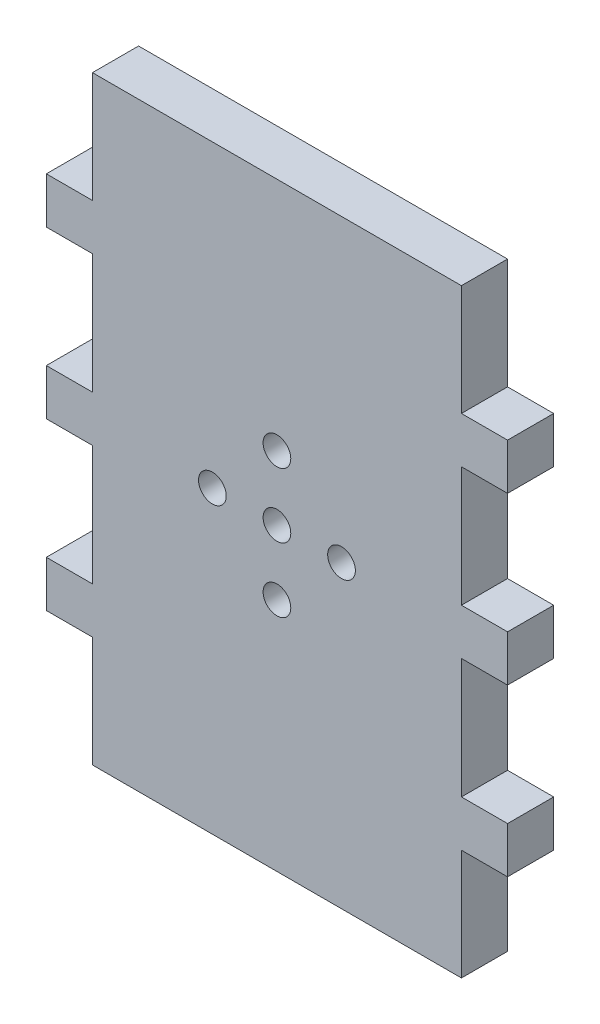
from build123d import *

# Parameters (mm, degrees)
SKETCH_3_R      = 1.5
EXTRUDE_2_DEPTH = 5


with BuildPart() as part:
    # 草图3 → 凸台-拉伸2 (new body)
    with BuildSketch(Plane.XY):
        Polygon((0, 0), (0, -12), (-5, -12), (-5, -17), (0, -17), (0, -30), (-5, -30), (-5, -35), (0, -35), (0, -48), (-5, -48), (-5, -53), (0, -53), (0, -65), (40, -65), (40, -53), (45, -53), (45, -48), (40, -48), (40, -35), (45, -35), (45, -30), (40, -30), (40, -17), (45, -17), (45, -12), (40, -12), (40, 0), align=None)
        with Locations((20, -32.5)):
            Circle(SKETCH_3_R, mode=Mode.SUBTRACT)
        with Locations((27, -32.5)):
            Circle(SKETCH_3_R, mode=Mode.SUBTRACT)
        with Locations((20, -25.5)):
            Circle(SKETCH_3_R, mode=Mode.SUBTRACT)
        with Locations((13, -32.5)):
            Circle(SKETCH_3_R, mode=Mode.SUBTRACT)
        with Locations((20, -39.5)):
            Circle(SKETCH_3_R, mode=Mode.SUBTRACT)
    extrude(amount=EXTRUDE_2_DEPTH)


solid = part.part
